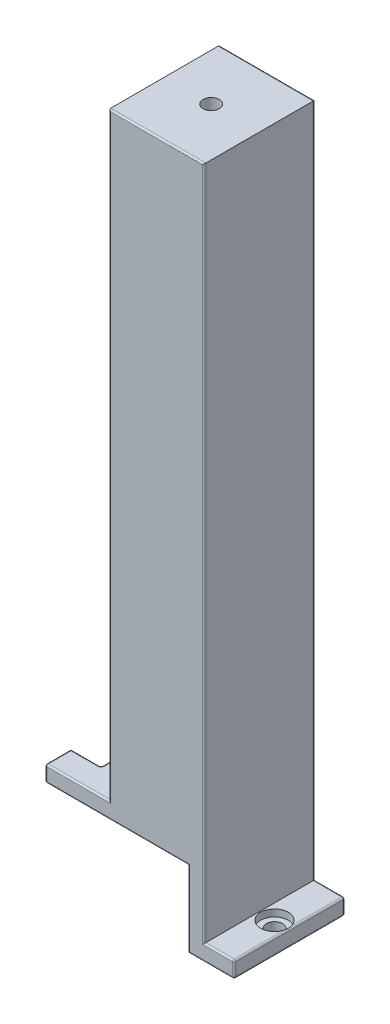
from build123d import *

# Parameters (mm, degrees)
BOSS_EXTRUDE1_DEPTH                     = 24
CUT_EXTRUDE2_REACH                      = 44.023
SKETCH2_W                               = 6.5
SKETCH2_H                               = 12.8
CUT_EXTRUDE3_REACH                      = 42.474
SKETCH3_R                               = 1.75
SKETCH10_W                              = 20.632153196
SKETCH10_H                              = 24
BOSS_EXTRUDE2_DEPTH                     = 130
FILLET1_R                               = 0.35
SKETCH8_R                               = 3
CUT_EXTRUDE5_DEPTH                      = 1.5
M3_5_CLEARANCE_HOLE1_D                  = 3.9
CBORE_FOR_M5_HEX_HEAD_BOLT1_D           = 3.5
CBORE_FOR_M5_HEX_HEAD_BOLT1_CBORE_D     = 6
CBORE_FOR_M5_HEX_HEAD_BOLT1_CBORE_DEPTH = 50


with BuildPart() as part:
    # Sketch1 → Boss-Extrude1 (new body)
    with BuildSketch(Plane.XY):
        Polygon((-28.105447381, 6.697250834), (2.894552619, 6.697250834), (2.894552619, -9.802749166), (12.894552619, -9.802749166), (12.894552619, -6.302749166), (6.394552619, -6.302749166), (6.394552619, 10.197250834), (-28.105447381, 10.197250834), align=None)
    extrude(amount=BOSS_EXTRUDE1_DEPTH)

    # Sketch2 → Cut-Extrude2 (cut, up to next)
    with BuildSketch(Plane(origin=(0, 10.197250834, 0), x_dir=(1, 0, 0), z_dir=(0, 1, 0)), mode=Mode.PRIVATE) as cut_extrude2_sk1:
        with Locations((-24.855447381, -12)):
            Rectangle(SKETCH2_W, SKETCH2_H)
    cut_extrude2_tool1 = extrude(cut_extrude2_sk1.sketch, amount=-CUT_EXTRUDE2_REACH, mode=Mode.PRIVATE) & part.part
    add(cut_extrude2_tool1.solids().sort_by_distance((-24.855447, 10.197251, 12))[0], mode=Mode.SUBTRACT)

    # Sketch3 → Cut-Extrude3 (cut, up to next)
    with BuildSketch(Plane(origin=(0, -6.302749166, 0), x_dir=(1, 0, 0), z_dir=(0, 1, 0)), mode=Mode.PRIVATE) as cut_extrude3_sk1:
        with Locations((9.644552619, -12)):
            Circle(SKETCH3_R)
    cut_extrude3_tool1 = extrude(cut_extrude3_sk1.sketch, amount=-CUT_EXTRUDE3_REACH, mode=Mode.PRIVATE) & part.part
    add(cut_extrude3_tool1.solids().sort_by_distance((9.644553, -6.302749, 12))[0], mode=Mode.SUBTRACT)

    # Sketch10 → Boss-Extrude2 (add)
    with BuildSketch(Plane(origin=(0, 10.197250834, 0), x_dir=(1, 0, 0), z_dir=(0, 1, 0))):
        with Locations((-3.921523979, -12)):
            Rectangle(SKETCH10_W, SKETCH10_H)
    extrude(amount=BOSS_EXTRUDE2_DEPTH)

    # Fillet1
    fillet1_edges = [part.edges().sort_by_distance(p)[0] for p in [
        (-21.605447381, 6.697250834, 12),
        (-21.605447381, 10.197250834, 12),
        (12.894552619, -9.802749166, 12),
        (12.894552619, -6.302749166, 12),
        (-12.605447381, 6.697250834, 0),
        (2.894552619, -1.552749166, 0),
        (7.894552619, -9.802749166, 0),
        (12.894552619, -8.052749166, 0),
        (9.644552619, -6.302749166, 0),
        (6.394552619, 66.947250834, 0),
        (-21.171523979, 10.197250834, 0),
        (-21.171523979, 10.197250834, 24),
        (6.394552619, 66.947250834, 24),
        (9.644552619, -6.302749166, 24),
        (12.894552619, -8.052749166, 24),
        (7.894552619, -9.802749166, 24),
        (2.894552619, -1.552749166, 24),
        (-12.605447381, 6.697250834, 24),
        (-28.105447381, 8.447250834, 0),
        (-28.105447381, 10.197250834, 2.8),
        (-28.105447381, 6.697250834, 2.8),
        (-28.105447381, 8.447250834, 24),
        (-28.105447381, 6.697250834, 21.2),
        (-28.105447381, 10.197250834, 21.2),
        (-28.105447381, 8.447250834, 5.6),
        (-24.855447381, 10.197250834, 5.6),
        (-21.605447381, 8.447250834, 5.6),
        (-24.855447381, 6.697250834, 5.6),
        (-21.605447381, 8.447250834, 18.4),
        (-24.855447381, 10.197250834, 18.4),
        (-28.105447381, 8.447250834, 18.4),
        (-24.855447381, 6.697250834, 18.4),
        (-3.921523979, 140.197250834, 0),
        (-14.237600577, 75.197250834, 0),
        (-14.237600577, 75.197250834, 24),
        (-3.921523979, 140.197250834, 24),
    ]]
    fillet(fillet1_edges, radius=FILLET1_R)

    # Sketch8 → Cut-Extrude5 (cut)
    with BuildSketch(Plane(origin=(0, -6.302749166, 0), x_dir=(1, 0, 0), z_dir=(0, 1, 0))):
        with Locations((9.644552619, -12)):
            Circle(SKETCH8_R)
    extrude(amount=-CUT_EXTRUDE5_DEPTH, mode=Mode.SUBTRACT)

    # M3.5 Clearance Hole1 (through all)
    with Locations(Plane(origin=(0, 6.697250834, 0), x_dir=(-1, 0, 0), z_dir=(0, -1, 0))):
        with Locations((18.355447381, -12)):
            Hole(M3_5_CLEARANCE_HOLE1_D / 2)

    # CBORE for M5 Hex Head Bolt1 (through all)
    with Locations(Plane(origin=(0, 6.697250834, 0), x_dir=(-1, 0, 0), z_dir=(0, -1, 0))):
        with Locations((4.105447381, -12)):
            CounterBoreHole(CBORE_FOR_M5_HEX_HEAD_BOLT1_D / 2, CBORE_FOR_M5_HEX_HEAD_BOLT1_CBORE_D / 2, CBORE_FOR_M5_HEX_HEAD_BOLT1_CBORE_DEPTH)


solid = part.part
